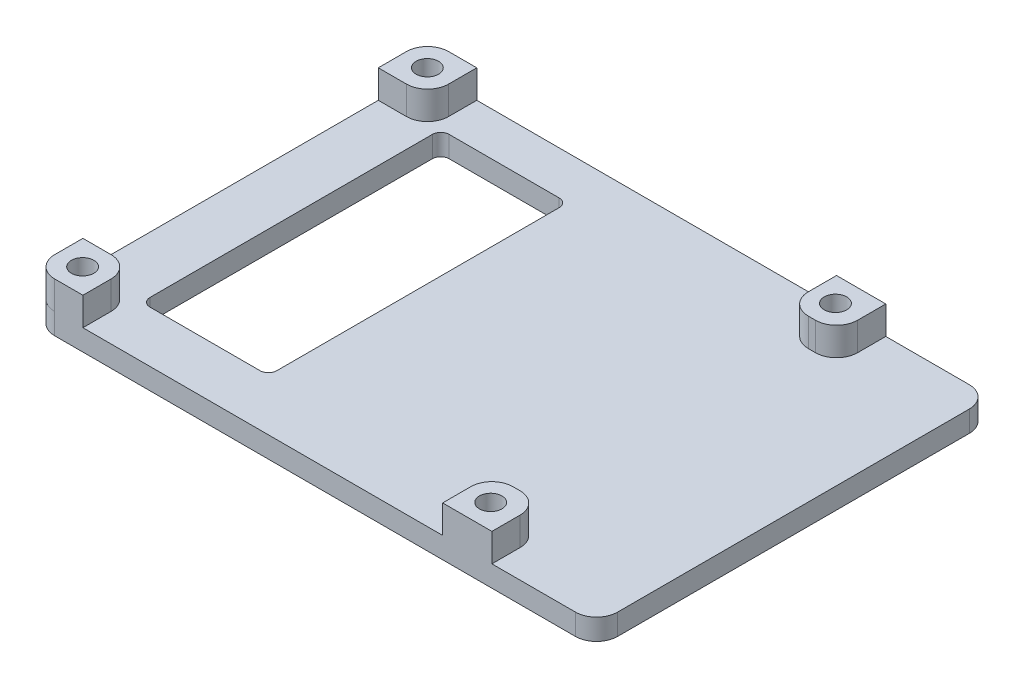
from build123d import *

# Parameters (mm, degrees)
SKETCH_1_R      = 1.6
EXTRUDE_1_DEPTH = 3
SKETCH_7_R      = 1.6
EXTRUDE_2_DEPTH = 4


with BuildPart() as part:
    # 草图1 → 凸台-拉伸1 (new body)
    with BuildSketch(Plane(origin=(0, 0, 0), x_dir=(1, 0, 0), z_dir=(0, 1, 0))):
        with BuildLine():
            Line((-0.009028181, 21.389975432), (-0.009028181, -28.591736531))
            ThreePointArc((-0.009028181, -28.591736531), (-0.887707838, -30.713056875), (-3.009028181, -31.591736531))
            Line((-3.009028181, -31.591736531), (-77.021723127, -31.591736531))
            ThreePointArc((-77.021723127, -31.591736531), (-79.134066788, -30.716775138), (-80.009028181, -28.604431477))
            Line((-80.009028181, -28.604431477), (-80.009028181, 21.402670377))
            ThreePointArc((-80.009028181, 21.402670377), (-79.134066788, 23.515014039), (-77.021723127, 24.389975432))
            Line((-77.021723127, 24.389975432), (-3.009028181, 24.389975432))
            ThreePointArc((-3.009028181, 24.389975432), (-0.887707838, 23.511295776), (-0.009028181, 21.389975432))
        make_face()
        with Locations((-76.52848462, 20.886724226)):
            Circle(SKETCH_1_R, mode=Mode.SUBTRACT)
        with Locations((-18.52858622, 20.886597225)):
            Circle(SKETCH_1_R, mode=Mode.SUBTRACT)
        with Locations((-18.52833222, -28.113656775)):
            Circle(SKETCH_1_R, mode=Mode.SUBTRACT)
        with Locations((-76.52833222, -28.113529775)):
            Circle(SKETCH_1_R, mode=Mode.SUBTRACT)
        with BuildLine():
            Line((-70.770059731, 18.230282987), (-55.140568984, 18.230282987))
            ThreePointArc((-55.140568984, 18.230282987), (-54.292040846, 17.878811124), (-53.940568984, 17.030282987))
            Line((-53.940568984, 17.030282987), (-53.940568984, -23.088422311))
            ThreePointArc((-53.940568984, -23.088422311), (-54.292040846, -23.936950448), (-55.140568984, -24.288422311))
            Line((-55.140568984, -24.288422311), (-70.770059731, -24.288422311))
            ThreePointArc((-70.770059731, -24.288422311), (-71.618587868, -23.936950448), (-71.970059731, -23.088422311))
            Line((-71.970059731, -23.088422311), (-71.970059731, 17.030282987))
            ThreePointArc((-71.970059731, 17.030282987), (-71.618587868, 17.878811124), (-70.770059731, 18.230282987))
        make_face(mode=Mode.SUBTRACT)
    extrude(amount=EXTRUDE_1_DEPTH)

    # 草图7 → 凸台-拉伸2 (add)
    # profile 1 of 4: a face of its own
    with BuildSketch(Plane(origin=(0, 3, 0), x_dir=(1, 0, 0), z_dir=(0, 1, 0))):
        with BuildLine():
            Line((-80.009028181, 17.389975432), (-76.009028181, 17.389975432))
            ThreePointArc((-76.009028181, 17.389975432), (-73.887707838, 18.268655088), (-73.009028181, 20.389975432))
            Line((-73.009028181, 20.389975432), (-73.009028181, 24.389975432))
            Line((-73.009028181, 24.389975432), (-77.009028181, 24.389975432))
            ThreePointArc((-77.009028181, 24.389975432), (-79.130348525, 23.511295776), (-80.009028181, 21.389975432))
            Line((-80.009028181, 21.389975432), (-80.009028181, 17.389975432))
        make_face()
        with Locations((-76.52848462, 20.886724226)):
            Circle(SKETCH_7_R, mode=Mode.SUBTRACT)
    # profile 2 of 4: a face of its own
    with BuildSketch(Plane(origin=(0, 3, 0), x_dir=(1, 0, 0), z_dir=(0, 1, 0))):
        with BuildLine():
            Line((-77.009028181, -31.591736531), (-73.009028181, -31.591736531))
            Line((-73.009028181, -31.591736531), (-73.009028181, -27.591736531))
            ThreePointArc((-73.009028181, -27.591736531), (-73.887707838, -25.470416188), (-76.009028181, -24.591736531))
            Line((-76.009028181, -24.591736531), (-80.009028181, -24.591736531))
            Line((-80.009028181, -24.591736531), (-80.009028181, -28.591736531))
            ThreePointArc((-80.009028181, -28.591736531), (-79.130348525, -30.713056875), (-77.009028181, -31.591736531))
        make_face()
        with Locations((-76.52833222, -28.113529775)):
            Circle(SKETCH_7_R, mode=Mode.SUBTRACT)
    # profile 3 of 4: a face of its own
    with BuildSketch(Plane(origin=(0, 3, 0), x_dir=(1, 0, 0), z_dir=(0, 1, 0))):
        with BuildLine():
            Line((-21.879941902, 24.389975432), (-21.879941902, 20.389975432))
            ThreePointArc((-21.879941902, 20.389975432), (-21.001262245, 18.268655088), (-18.879941902, 17.389975432))
            Line((-18.879941902, 17.389975432), (-17.879941902, 17.389975432))
            ThreePointArc((-17.879941902, 17.389975432), (-15.758621558, 18.268655088), (-14.879941902, 20.389975432))
            Line((-14.879941902, 20.389975432), (-14.879941902, 24.389975432))
            Line((-14.879941902, 24.389975432), (-21.879941902, 24.389975432))
        make_face()
        with Locations((-18.52858622, 20.886597225)):
            Circle(SKETCH_7_R, mode=Mode.SUBTRACT)
    # profile 4 of 4: a face of its own
    with BuildSketch(Plane(origin=(0, 3, 0), x_dir=(1, 0, 0), z_dir=(0, 1, 0))):
        with BuildLine():
            Line((-18.879941902, -24.591736531), (-17.879941902, -24.591736531))
            ThreePointArc((-17.879941902, -24.591736531), (-15.758621558, -25.470416188), (-14.879941902, -27.591736531))
            Line((-14.879941902, -27.591736531), (-14.879941902, -31.591736531))
            Line((-14.879941902, -31.591736531), (-21.879941902, -31.591736531))
            Line((-21.879941902, -31.591736531), (-21.879941902, -27.591736531))
            ThreePointArc((-21.879941902, -27.591736531), (-21.001262245, -25.470416188), (-18.879941902, -24.591736531))
        make_face()
        with Locations((-18.52833222, -28.113656775)):
            Circle(SKETCH_7_R, mode=Mode.SUBTRACT)
    extrude(amount=EXTRUDE_2_DEPTH)


solid = part.part
